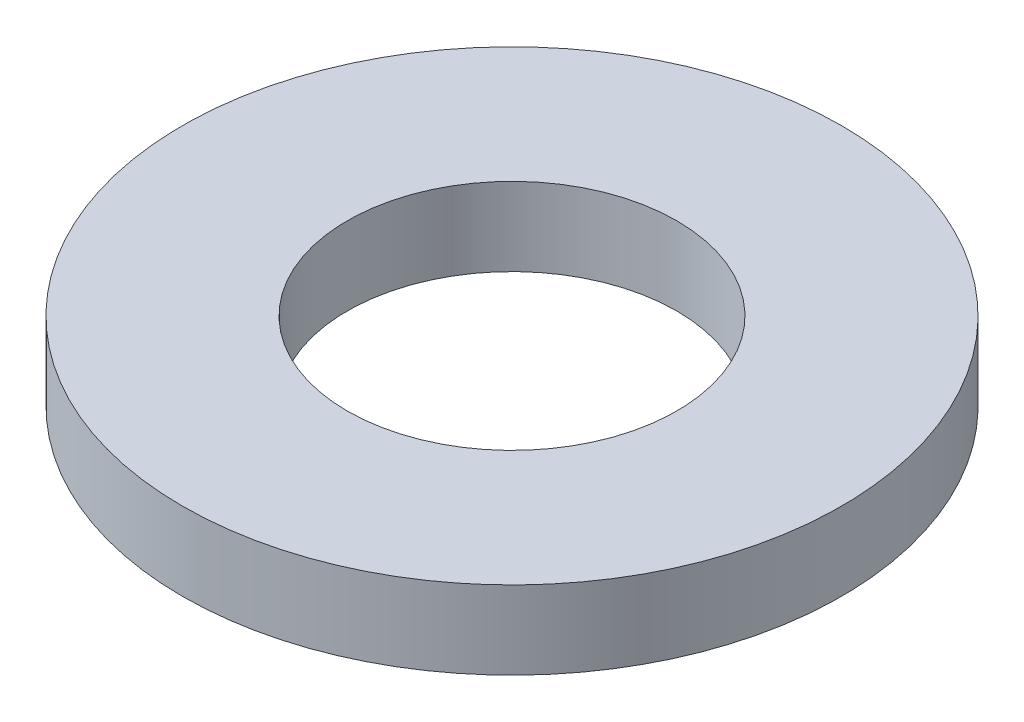
from build123d import *

# Parameters (mm, degrees)
SKETCH1_R           = 3.9624
BOSS_EXTRUDE1_DEPTH = 0.9398
SKETCH5_R           = 1.9812
CUT_EXTRUDE1_DEPTH  = 6.681940827


with BuildPart() as part:
    # Sketch1 → Boss-Extrude1 (new body)
    with BuildSketch(Plane(origin=(0, 0, 0), x_dir=(1, 0, 0), z_dir=(0, 1, 0))):
        Circle(SKETCH1_R)
    extrude(amount=BOSS_EXTRUDE1_DEPTH)

    # Sketch5 → Cut-Extrude1 (cut, through all)
    with BuildSketch(Plane(origin=(0, 0.9398, 0), x_dir=(-1, 0, 0), z_dir=(0, 1, 0))):
        Circle(SKETCH5_R)
    extrude(amount=-CUT_EXTRUDE1_DEPTH, mode=Mode.SUBTRACT)


solid = part.part
